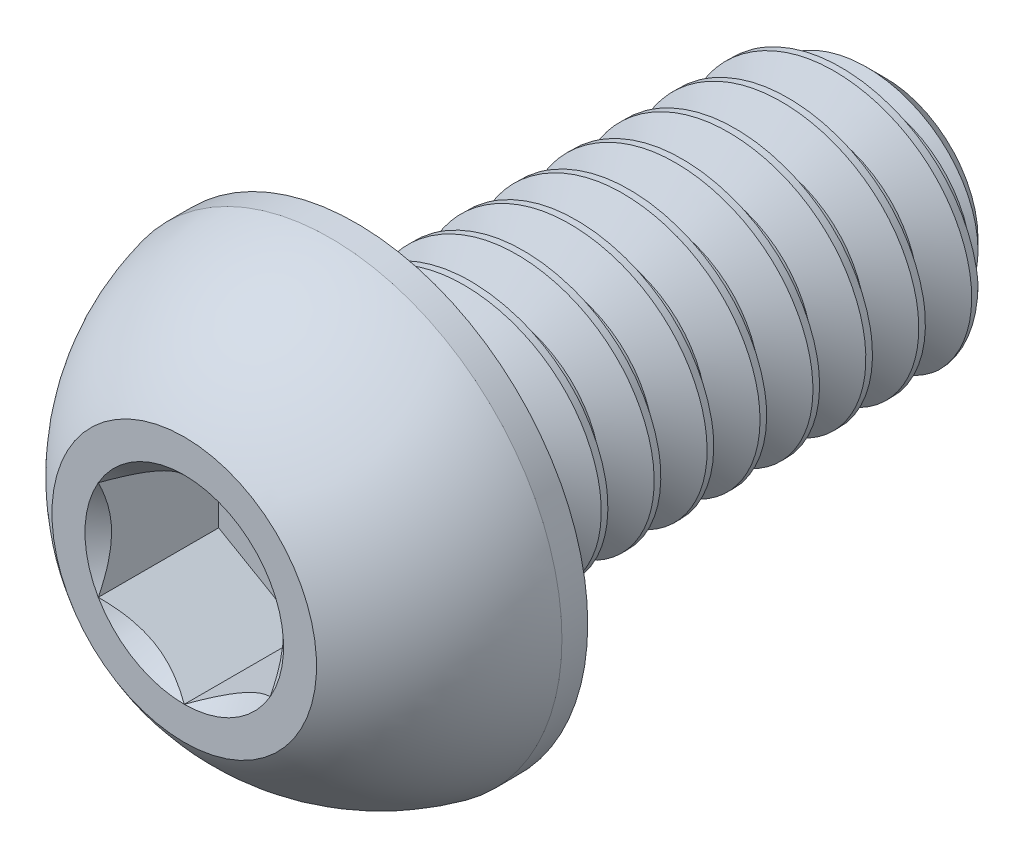
from build123d import *

# Parameters (mm, degrees)
CUT_EXTRUDE2_DEPTH = 0.91
CUT_SWEEP2_PITCH   = 0.4


# Read off the part's stored shape, not the designer's step: Split1
with BuildPart() as part:
    # Sketch10 → Revolve3 (revolve)
    with BuildSketch(Plane(origin=(0, 0, 0), x_dir=(0, 0, -1), z_dir=(1, 0, 0)), mode=Mode.PRIVATE) as revolve3_sk:
        Polygon((5, 1), (5.3, 0.7), (5.3, 0), (1.3, 0), (1.3, 1), align=None)
    revolve(revolve3_sk.sketch.rotate(Axis((0, 0, 0), (0, 0, -1)), 90), axis=Axis((0, 0, 0), (0, 0, -1)))

    # Sketch7 → Revolve2 (revolve)
    with BuildSketch(Plane(origin=(0, 0, 0), x_dir=(0, 0, -1), z_dir=(1, 0, 0)), mode=Mode.PRIVATE) as revolve2_sk:
        with BuildLine():
            Line((1.105, 1.75), (1.3, 1.75))
            Line((1.3, 1.75), (1.3, 0))
            Line((1.3, 0), (0, 0))
            Line((0, 0), (0, 1))
            ThreePointArc((0, 1), (0.479976957, 1.481850617), (1.105, 1.75))
        make_face()
    revolve(revolve2_sk.sketch.rotate(Axis((0, 0, 0), (0, 0, -1)), 180), axis=Axis((0, 0, 0), (0, 0, -1)))

    # Sketch5 → Cut-Extrude2 (cut)
    with BuildSketch(Plane.XY):
        Polygon((0.65, -0.375277675), (0.65, 0.375277675), (0, 0.75055535), (-0.65, 0.375277675), (-0.65, -0.375277675), (0, -0.75055535), align=None)
    extrude(amount=-CUT_EXTRUDE2_DEPTH, mode=Mode.SUBTRACT)

    # Cut-Extrude3 cone 1 section (through the dimple's axis) → Cut-Extrude3 (revolve, cut)
    with BuildSketch(Plane(origin=(0, 0, 0), x_dir=(0, -1, 0), z_dir=(1, 0, 0))):
        Polygon((0, 0), (0.75055535, 0), (0, 0.75055535), align=None)
    revolve(axis=Axis((0, 0, 0), (0, 0, -1)), mode=Mode.SUBTRACT)


with BuildPart() as body_2:
    # Split1: the piece on the far side of the plane
    add(part.part)
    split(bisect_by=Plane.XY.offset(-1.3), keep=Keep.BOTTOM)

    # Cut-Sweep2: the profile of Sketch12 screwed along a right-hand helix of 13.25 turns, 6 arcs to a turn; built about Z, then put on its axis
    cut_sweep2_z = Axis((0, 0, 0), (0, 0, 1))
    cut_sweep2_corners = [(0.740192379, 0, -0.15), (0.740192379, 0, -0.2), (1.021650635, 0, -0.3625), (1.021650635, 0, 0.0125)]
    with BuildLine(mode=Mode.PRIVATE) as cut_sweep2_profile:
        Line(cut_sweep2_corners[0], cut_sweep2_corners[1])
        Line(cut_sweep2_corners[1], cut_sweep2_corners[2])
        Line(cut_sweep2_corners[2], cut_sweep2_corners[3])
        Line(cut_sweep2_corners[3], cut_sweep2_corners[0])
    cut_sweep2_cap = Face(cut_sweep2_profile.wire())
    cut_sweep2_turn_angles = [0, 30, 60, 90, 120, 150, 180, 210, 240, 270, 300, 330, 360]
    cut_sweep2_turn_weights = [1, 0.8660254037844387, 1, 0.8660254037844387, 1, 0.8660254037844387, 1, 0.8660254037844387, 1, 0.8660254037844387, 1, 0.8660254037844387, 1]
    cut_sweep2_turn_rails = [Edge.make_bspline([Vector(p[0], p[1], 0).rotate(cut_sweep2_z, cut_sweep2_turn_angles[k]) / cut_sweep2_turn_weights[k] + Vector(0, 0, p[2] + CUT_SWEEP2_PITCH * cut_sweep2_turn_angles[k] / 360) for k in range(13)], [0, 0, 0, 1, 1, 2, 2, 3, 3, 4, 4, 5, 5, 6, 6, 6], 2, cut_sweep2_turn_weights) for p in cut_sweep2_corners]
    cut_sweep2_turn_sides = [Face.make_surface_from_curves(cut_sweep2_turn_rails[p[0]], cut_sweep2_turn_rails[p[1]]) for p in [(0, 1), (1, 2), (2, 3), (3, 0)]]
    cut_sweep2_turn = Solid(Shell([*cut_sweep2_turn_sides, cut_sweep2_cap, cut_sweep2_cap.rotate(cut_sweep2_z, 360).moved(Location((0, 0, CUT_SWEEP2_PITCH * 360 / 360)))]))
    cut_sweep2_last_angles = [4680, 4710, 4740, 4755, 4770]
    cut_sweep2_last_weights = [1, 0.8660254037844387, 1, 0.965925826289056, 1]
    cut_sweep2_last_rails = [Edge.make_bspline([Vector(p[0], p[1], 0).rotate(cut_sweep2_z, cut_sweep2_last_angles[k]) / cut_sweep2_last_weights[k] + Vector(0, 0, p[2] + CUT_SWEEP2_PITCH * cut_sweep2_last_angles[k] / 360) for k in range(5)], [0, 0, 0, 1, 1, 2, 2, 2], 2, cut_sweep2_last_weights) for p in cut_sweep2_corners]
    cut_sweep2_last_sides = [Face.make_surface_from_curves(cut_sweep2_last_rails[p[0]], cut_sweep2_last_rails[p[1]]) for p in [(0, 1), (1, 2), (2, 3), (3, 0)]]
    cut_sweep2_last = Solid(Shell([*cut_sweep2_last_sides, cut_sweep2_cap.rotate(cut_sweep2_z, 4680).moved(Location((0, 0, CUT_SWEEP2_PITCH * 4680 / 360))), cut_sweep2_cap.rotate(cut_sweep2_z, 4770).moved(Location((0, 0, CUT_SWEEP2_PITCH * 4770 / 360)))]))
    cut_sweep2_each = [*[cut_sweep2_turn.moved(Location((0, 0, CUT_SWEEP2_PITCH * i))) for i in range(13)], cut_sweep2_last]
    add(Plane(origin=(0, 0, -5.3), x_dir=(0, 1, 0), z_dir=(0, 0, 1)) * Compound([cut_sweep2_each[i] for i in range(0, 14, 2)]), mode=Mode.SUBTRACT)
    add(Plane(origin=(0, 0, -5.3), x_dir=(0, 1, 0), z_dir=(0, 0, 1)) * Compound([cut_sweep2_each[i] for i in range(1, 14, 2)]), mode=Mode.SUBTRACT)


with BuildPart() as part_1:
    add(part.part)

    # Split1
    split(bisect_by=Plane.XY.offset(-1.3), keep=Keep.TOP)

    add(body_2.part)  # Boss-Extrude1 merges body 2
    # Boss-Extrude1 cone 1 section (through the dimple's axis) → Boss-Extrude1 (revolve)
    with BuildSketch(Plane(origin=(0, 0, -1.3), x_dir=(0, -1, 0), z_dir=(1, 0, 0))):
        Polygon((0, 0), (1, 0), (0, 1), align=None)
    revolve(axis=Axis((0, 0, -1.3), (0, 0, -1)))


solid = part_1.part
